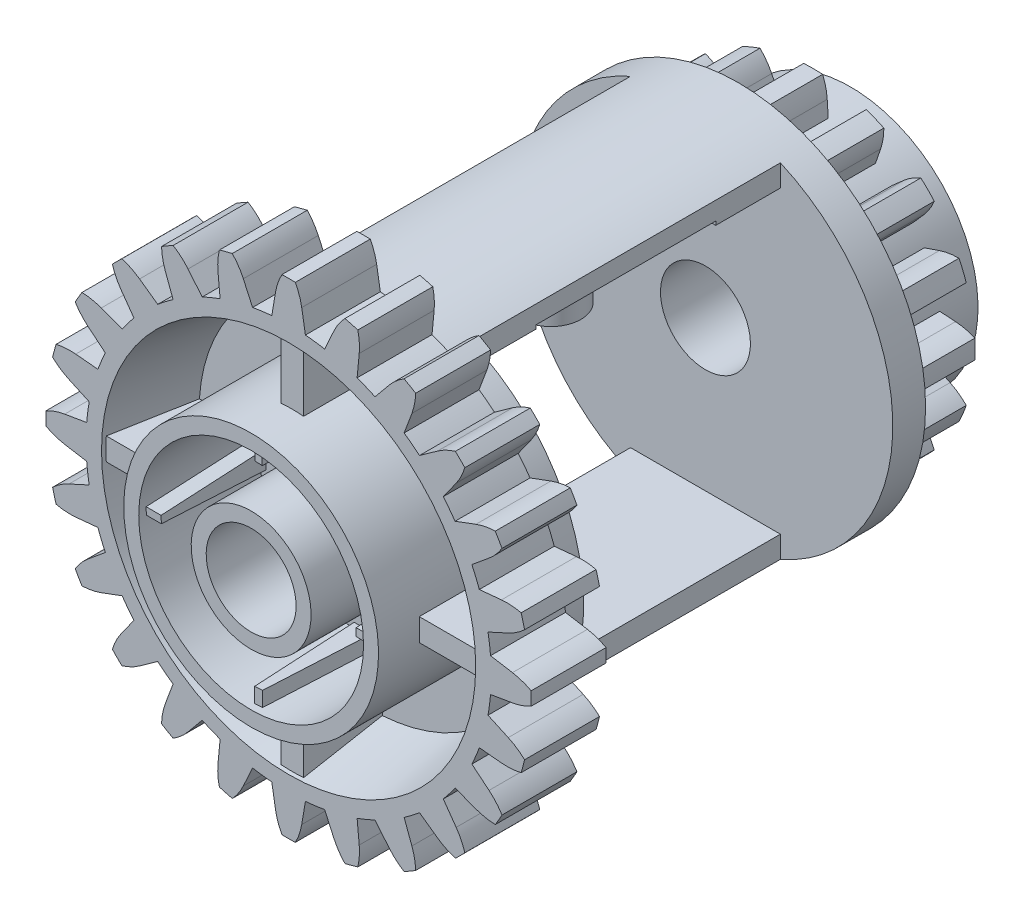
from build123d import *
from build123d.topology import SkipClean

# Parameters (mm, degrees)
REVOLVE1_ANGLE                  = 180
CUT_EXTRUDE2_DEPTH              = 25.318820685
CUT_EXTRUDE2_DEPTH_BACK         = 25.318820685
SKETCH3_W                       = 6
SKETCH3_H                       = 16.5
CUT_EXTRUDE3_DEPTH              = 4
CUT_EXTRUDE5_START              = -4
CUT_EXTRUDE5_DEPTH              = 4
CIRPATTERN1_COUNT               = 24
CUT_EXTRUDE6_REACH              = 37.148
CIRPATTERN2_COUNT               = 16
SKETCH9_R                       = 1.6
BOSS_EXTRUDE1_DEPTH             = 3.15
BOSS_EXTRUDE1_DIRECTION_2_REACH = 31.37
BOSS_EXTRUDE2_DEPTH             = 4.2
BOSS_EXTRUDE3_DEPTH             = 1.2
CIRPATTERN3_COUNT               = 4


# Read off the part's stored shape, not the designer's step: Cut-Extrude3
with BuildPart() as part:
    # Sketch2 → Revolve1 (revolve)
    with BuildSketch(Plane(origin=(0, 0, 0), x_dir=(0, 0, -1), z_dir=(1, 0, 0))):
        Polygon((16, 6), (9.999760964, 6), (9.999872518, 3.2), (16, 3.2), (16, 2.4), (8.25, 2.4), (8.25, 8), (-8.25, 8), (-8.25, 2.4), (-16, 2.4), (-16, 3.2), (-9.6, 3.2), (-9.6, 6), (-16.000001235, 6), (-16.000001235, 6.8), (-9.6, 6.8), (-9.6, 9.181199163), (-14, 9.98633448), (-14, 12.95), (-10, 12.95), (-10, 10), (9.999601602, 10), (9.999655386, 8.65), (13.999655386, 8.65), (13.999655386, 6.8), (16, 6.8), align=None)
    revolve(axis=Axis((0, 0, -5.047405581), (0, 0, -1)), revolution_arc=REVOLVE1_ANGLE)

    # Sketch3 → Cut-Extrude2 (cut, two sides: drawn at the far end of the back side and taken through both)
    with BuildSketch(Plane(origin=(0, 0, 0), x_dir=(1, 0, 0), z_dir=(0, 1, 0)).offset(-CUT_EXTRUDE2_DEPTH_BACK)):
        with Locations((7, 0)):
            Rectangle(SKETCH3_W, SKETCH3_H)
    extrude(amount=CUT_EXTRUDE2_DEPTH + CUT_EXTRUDE2_DEPTH_BACK, mode=Mode.SUBTRACT)

    # Cut-Extrude3 outline → Cut-Extrude3 (cut)
    with BuildSketch(Plane(origin=(0, 0, 0), x_dir=(0, 0, -1), z_dir=(1, 0, 0))):
        Polygon((-4.8, 8.2), (-4.8, 8), (-8.25, 8), (-8.25, -8), (8.25, -8), (8.25, 8), (4.8, 8), (4.8, 8.2), align=None)
    extrude(amount=CUT_EXTRUDE3_DEPTH, mode=Mode.SUBTRACT)

    # Mirror1: part across plane


with BuildPart() as part_1:
    with SkipClean():  # the faces are left unmerged after this step: merging them gives an invalid solid
        add(part.part)
        add(part.part.mirror(Plane(origin=(0, 0, 0), x_dir=(0, 0, 1), z_dir=(1, 0, 0))))

    # Sketch7 → Cut-Extrude5 (cut)
    with SkipClean():  # the faces are left unmerged after this step: merging them gives an invalid solid
        with BuildSketch(Plane.XY.offset(14).offset(CUT_EXTRUDE5_START)):
            with BuildLine():
                Line((0.896831614, 10.777751289), (0.699999975, 11.950000189))
                ThreePointArc((0.699999975, 11.950000189), (0.569911108, 12.461711184), (0.357450414, 12.945065825))
                ThreePointArc((0.357450414, 12.945065825), (1.690314195, 12.839210954), (3.005159001, 12.596488375))
                ThreePointArc((3.005159001, 12.596488375), (2.674836259, 12.184592379), (2.416739473, 11.723986827))
                Line((2.416739473, 11.723986827), (1.923214644, 10.642625391))
                ThreePointArc((1.923214644, 10.642625391), (1.411640881, 10.722476384), (0.896831614, 10.777751289))
            make_face()
        cut_extrude5 = extrude(amount=CUT_EXTRUDE5_DEPTH, mode=Mode.SUBTRACT)

    # CirPattern1: Cut-Extrude5 ×24 about axis
    with SkipClean():  # the faces are left unmerged after this step: merging them gives an invalid solid
        cirpattern1_axis = Axis((0, 0, 0), (0, 0, 1))
        for i in range(1, CIRPATTERN1_COUNT):
            add(cut_extrude5.rotate(cirpattern1_axis, i * 360 / CIRPATTERN1_COUNT), mode=Mode.SUBTRACT)

    # Cut-Extrude6: up to this cone (the profile starts outside it)
    with SkipClean():  # the faces are left unmerged after this step: merging them gives an invalid solid
        cut_extrude6_end = Plane(origin=(0, 0, -13.999655), z_dir=(0, 0, 1)).offset(3.999655992) * Cone(0.025100006, 844573.64830108, 33.648344008, align=(Align.CENTER, Align.CENTER, Align.MIN), mode=Mode.PRIVATE)
        # Sketch8 → Cut-Extrude6 (cut, up to the surface)
        with BuildSketch(Plane(origin=(0, 0, -13.999655386), x_dir=(-1, 0, 0), z_dir=(0, 0, -1)), mode=Mode.PRIVATE) as cut_extrude6_sk1:
            with BuildLine():
                Line((-0.750000007, 7.600000128), (-0.803910126, 6.752312827))
                ThreePointArc((-0.803910126, 6.752312827), (-1.326614178, 6.669339909), (-1.841282114, 6.545966711))
                Line((-1.841282114, 6.545966711), (-2.21548439, 7.308497094))
                ThreePointArc((-2.21548439, 7.308497094), (-2.489602605, 7.766147361), (-2.835940075, 8.17189965))
                ThreePointArc((-2.835940075, 8.17189965), (-1.687531246, 8.483792683), (-0.507183536, 8.635118115))
                ThreePointArc((-0.507183536, 8.635118115), (-0.671882959, 8.127714305), (-0.750000007, 7.600000128))
            make_face()
        cut_extrude6_tool1 = extrude(cut_extrude6_sk1.sketch, amount=-CUT_EXTRUDE6_REACH, mode=Mode.PRIVATE) - cut_extrude6_end
        cut_extrude6 = cut_extrude6_tool1.solids().sort_by_distance((1.527377, 7.678642, -13.999655))[0]
        add(cut_extrude6, mode=Mode.SUBTRACT)

    # CirPattern2: Cut-Extrude6 ×16 about axis
    with SkipClean():  # the faces are left unmerged after this step: merging them gives an invalid solid
        cirpattern2_axis = Axis((0, 0, 0), (0, 0, 1))
        for i in range(1, CIRPATTERN2_COUNT):
            add(cut_extrude6.rotate(cirpattern2_axis, i * 360 / CIRPATTERN2_COUNT), mode=Mode.SUBTRACT)

    # Sketch9 → Boss-Extrude1 (add)
    with SkipClean():  # the faces are left unmerged after this step: merging them gives an invalid solid
        with BuildSketch(Plane.XZ.offset(-8)):
            with Locations(Location((0, 0, 0), (0, 0, 270))):
                Circle(SKETCH9_R)
        extrude(amount=BOSS_EXTRUDE1_DEPTH)

    # Sketch9 → Boss-Extrude1 direction 2 (add, up to next)
    with BuildSketch(Plane.XZ.offset(-8), mode=Mode.PRIVATE) as boss_extrude1_direction_2_sk1:
        with Locations(Location((0, 0, 0), (0, 0, 270))):
            Circle(SKETCH9_R)
    boss_extrude1_direction_2_tool1 = extrude(boss_extrude1_direction_2_sk1.sketch, amount=-BOSS_EXTRUDE1_DIRECTION_2_REACH, mode=Mode.PRIVATE) - part_1.part
    add(boss_extrude1_direction_2_tool1.solids().sort_by_distance((0, 8, 0))[0])

    # Sketch10 → Boss-Extrude2 (add)
    with BuildSketch(Plane.XY.offset(9.6)):
        with BuildLine():
            Line((9.968293555, 0.59999997), (6.773402874, 0.600843991))
            ThreePointArc((6.773402874, 0.600843991), (6.8, 0), (6.773402874, -0.600843991))
            Line((6.773402874, -0.600843991), (9.968293555, -0.59999997))
            ThreePointArc((9.968293555, -0.59999997), (9.98633448, 0), (9.968293555, 0.59999997))
        make_face()
    boss_extrude2 = extrude(amount=BOSS_EXTRUDE2_DEPTH)

    # Sketch11 → Boss-Extrude3 (add)
    with BuildSketch(Plane(origin=(5.2, 0, 0), x_dir=(0, 0, -1), z_dir=(1, 0, 0))):
        Polygon((-15.608049738, -0.19983793), (-10, -0.5), (-10, 0.5), (-15.591949815, 0.19983793), align=None)
        Polygon((9.999999776, 0.5), (15.599999776, 0.2), (15.599999776, -0.2), (9.999999776, -0.5), align=None)
    boss_extrude3 = extrude(amount=BOSS_EXTRUDE3_DEPTH)

    # CirPattern3: Boss-Extrude2, Boss-Extrude3 ×4 about axis
    cirpattern3_axis = Axis((0, 0, 0), (0, 0, 1))
    add([boss_extrude2.rotate(cirpattern3_axis, i * 360 / CIRPATTERN3_COUNT) for i in range(1, CIRPATTERN3_COUNT)])
    add([boss_extrude3.rotate(cirpattern3_axis, i * 360 / CIRPATTERN3_COUNT) for i in range(1, CIRPATTERN3_COUNT)])


solid = part_1.part
